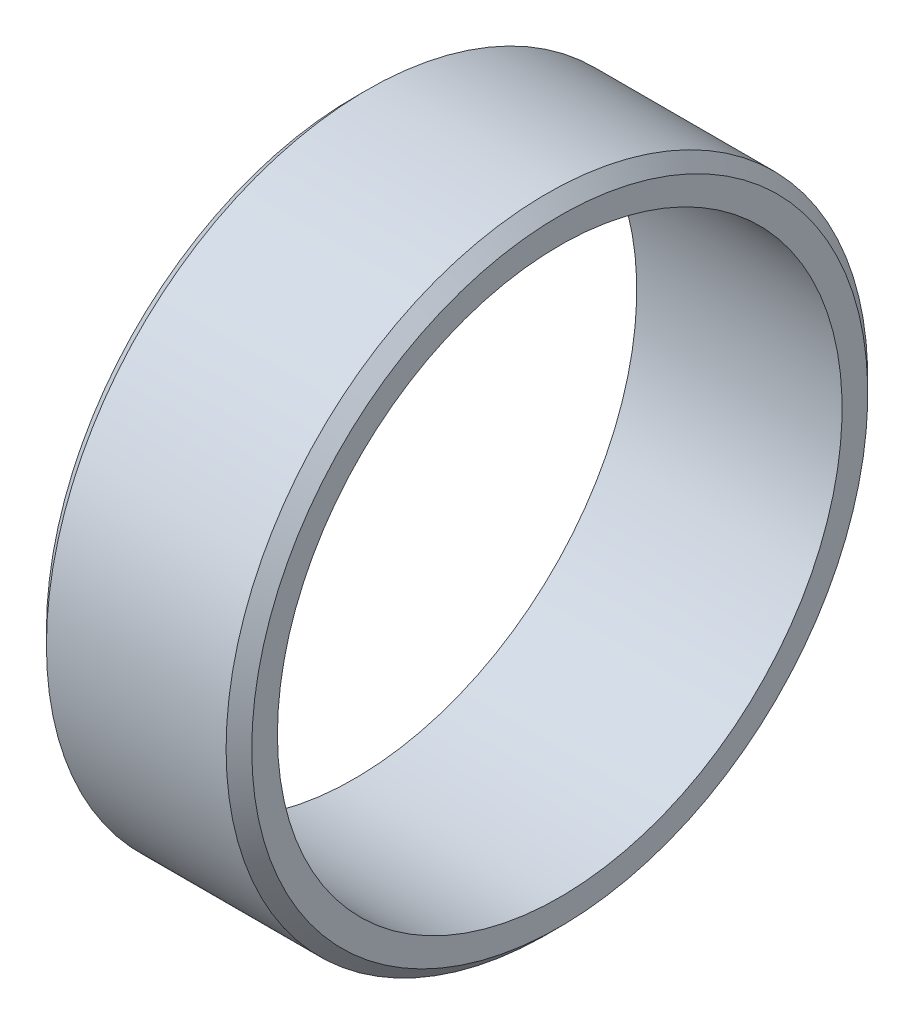
from build123d import *


with BuildPart() as part:
    # Esquisse1 → Base-Révolution (revolve)
    with BuildSketch(Plane.XY):
        Polygon((0, 22), (16, 22), (16, 24), (15, 25), (1, 25), (0, 24), align=None)
    revolve(axis=Axis((0, 0, 0), (1, 0, 0)))


solid = part.part
